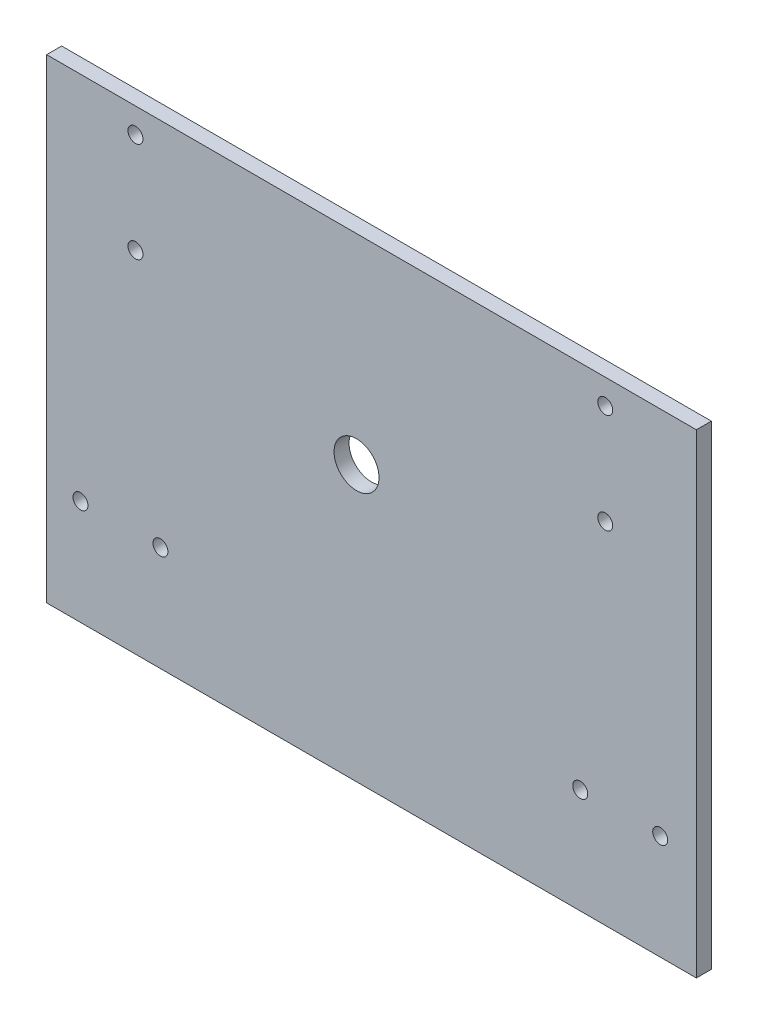
from build123d import *

# Parameters (mm, degrees)
SKETCH_1_W          = 130
SKETCH_1_H          = 95
EXTRUDE_1_DEPTH     = 3
SKETCH_3_R          = 1.5
CUT_EXTRUDE_2_DEPTH = 10
SKETCH_4_R          = 1.5
CUT_EXTRUDE_3_DEPTH = 10
SKETCH_9_R          = 4.5
CUT_EXTRUDE_4_DEPTH = 10


with BuildPart() as part:
    # 草图1 → 凸台-拉伸1 (new body)
    with BuildSketch(Plane.XY):
        Rectangle(SKETCH_1_W, SKETCH_1_H)
    extrude(amount=EXTRUDE_1_DEPTH)

    # 草图3 → 切除-拉伸2 (cut)
    with BuildSketch(Plane(origin=(0, 0, 0), x_dir=(-1, 0, 0), z_dir=(0, 0, -1))):
        with Locations((-57.767112616, -26.5)):
            Circle(SKETCH_3_R)
        with Locations((-41.767112616, -26.5)):
            Circle(SKETCH_3_R)
        with Locations((42.232887384, -26.5)):
            Circle(SKETCH_3_R)
        with Locations((58.232887384, -26.5)):
            Circle(SKETCH_3_R)
    extrude(amount=-CUT_EXTRUDE_2_DEPTH, mode=Mode.SUBTRACT)

    # 草图4 → 切除-拉伸3 (cut)
    with BuildSketch(Plane(origin=(0, 0, 0), x_dir=(-1, 0, 0), z_dir=(0, 0, -1))):
        with Locations((-46.767112616, 42.5)):
            Circle(SKETCH_4_R)
        with Locations((-46.767112616, 22.5)):
            Circle(SKETCH_4_R)
        with Locations((47.232887384, 42.5)):
            Circle(SKETCH_4_R)
        with Locations((47.232887384, 22.5)):
            Circle(SKETCH_4_R)
    extrude(amount=-CUT_EXTRUDE_3_DEPTH, mode=Mode.SUBTRACT)

    # 草图9 → 切除-拉伸4 (cut)
    with BuildSketch(Plane.XY.offset(3)):
        with Locations((-3, 7.452587902)):
            Circle(SKETCH_9_R)
    extrude(amount=-CUT_EXTRUDE_4_DEPTH, mode=Mode.SUBTRACT)


solid = part.part
